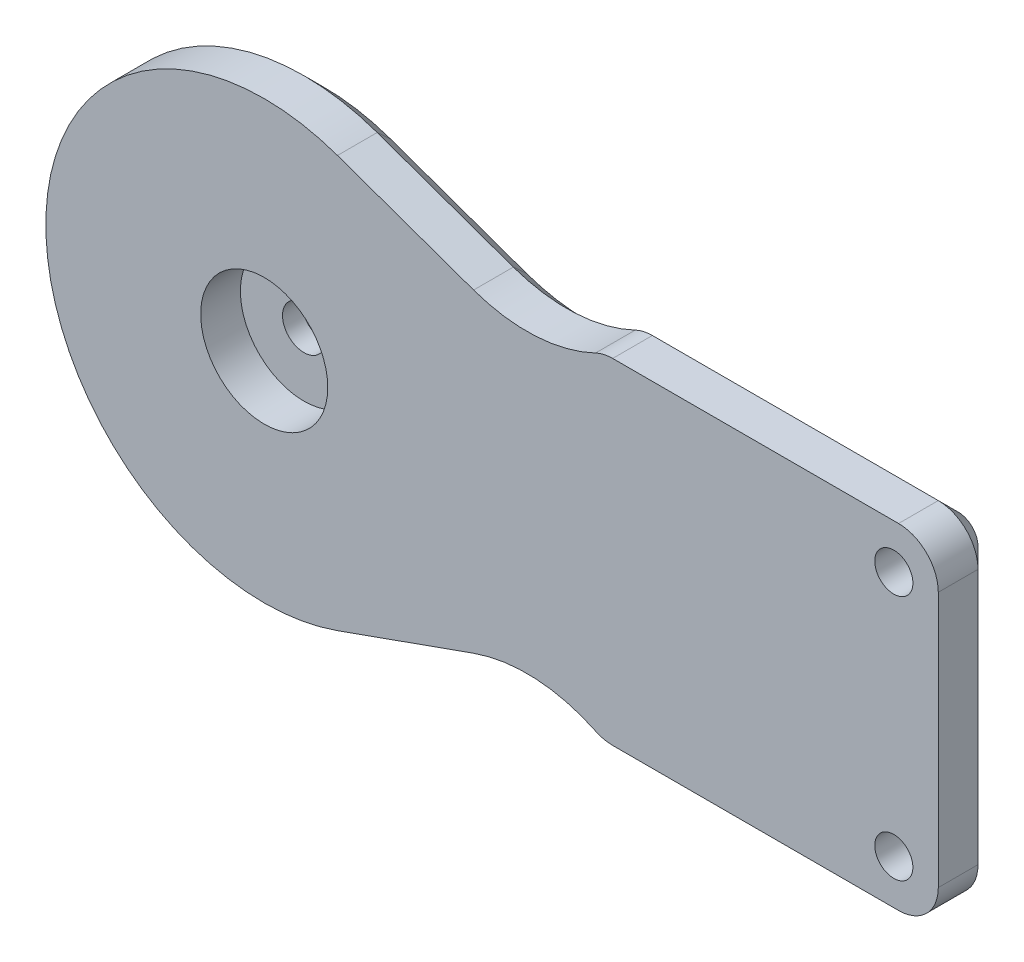
from build123d import *

# Parameters (mm, degrees)
SKETCH1_R                    = 1.5
SKETCH1_R_2                  = 2.7
BOSS_EXTRUDE1_DEPTH          = 7.5
SKETCH3_R                    = 8
CUT_EXTRUDE2_DEPTH           = 5
FILLET2_R                    = 20
TALADRO_DE_MARGEN_PARA_M41_D = 4.8
FILLET3_R                    = 5
CHAMFER1_SIZE                = 2.5
SKETCH7_W                    = 10.89
SKETCH7_H                    = 9.13
SKETCH7_W_2                  = 8.49
SKETCH7_H_2                  = 6.73
BOSS_EXTRUDE2_DEPTH          = 15
FILLET5_R                    = 2.5


with BuildPart() as part:
    # Sketch1 → Boss-Extrude1 (new body)
    with BuildSketch(Plane.XY):
        with BuildLine():
            Line((42.669600757, 14), (42.669600757, 21.1))
            Line((42.669600757, 21.1), (84.869600757, 21.1))
            Line((84.869600757, 21.1), (84.869600757, -21.1))
            Line((84.869600757, -21.1), (42.669600757, -21.1))
            Line((42.669600757, -21.1), (42.669600757, -14))
            Line((42.669600757, -14), (9.223174911, -25.907200632))
            ThreePointArc((9.223174911, -25.907200632), (-27.5, 0), (9.223174911, 25.907200632))
            Line((9.223174911, 25.907200632), (42.669600757, 14))
        make_face()
        with Locations((79.269600757, 15.5)):
            Circle(SKETCH1_R, mode=Mode.SUBTRACT)
        with Locations((79.269600757, -15.5)):
            Circle(SKETCH1_R, mode=Mode.SUBTRACT)
        Circle(SKETCH1_R_2, mode=Mode.SUBTRACT)
    extrude(amount=BOSS_EXTRUDE1_DEPTH)

    # Sketch3 → Cut-Extrude2 (cut)
    with BuildSketch(Plane.XY.offset(7.5)):
        Circle(SKETCH3_R)
    extrude(amount=-CUT_EXTRUDE2_DEPTH, mode=Mode.SUBTRACT)

    # Fillet2
    # the kernel refuses this fillet: 20 mm, written as the material it adds along each edge
    with BuildSketch(Plane(origin=(42.669600757, -14, 0), x_dir=(-0.9420800229659998, -0.3353881785757827, 0), z_dir=(0, 0, 1))) as fillet2_piece_1:
        with BuildLine():
            CenterArc((17.308114645, 20), FILLET2_R, 221.725423621, 48.274576379)
            Line((2.381256068, 6.688768163), (2.082718896, 6.422543526))
            ThreePointArc((2.082718896, 6.422543526), (0.813796025, 3.478539353), (-0.376832009, 0.134155271))
            Line((-0.376832009, 0.134155271), (0, -0.4))
            Line((0, -0.4), (17.308114645, -0.4))
            Line((17.308114645, -0.4), (17.308114645, 0))
        make_face()
    extrude(amount=7.5)
    with BuildSketch(Plane(origin=(42.669600757, 14, 0), x_dir=(-0.9420800229659999, 0.3353881785757825, 0), z_dir=(0, 0, 1))) as fillet2_piece_2:
        with BuildLine():
            CenterArc((17.308114645, -20), FILLET2_R, 90, 48.274576379)
            Line((2.381256068, -6.688768163), (2.082718896, -6.422543526))
            ThreePointArc((2.082718896, -6.422543526), (0.813796025, -3.478539353), (-0.376832009, -0.134155271))
            Line((-0.376832009, -0.134155271), (0, 0.4))
            Line((0, 0.4), (17.308114645, 0.4))
            Line((17.308114645, 0.4), (17.308114645, 0))
        make_face()
    extrude(amount=7.5)

    # Taladro de margen para M41 (through all)
    with Locations(Plane.XY.offset(7.5)):
        with Locations((79.269600757, -15.5), (79.269600757, 15.5)):
            Hole(TALADRO_DE_MARGEN_PARA_M41_D / 2)

    # Fillet3
    fillet3_edges = [part.edges().sort_by_distance(p)[0] for p in [
        (42.669600757, 21.1, 3.75),
        (84.869600757, 21.1, 3.75),
        (84.869600757, -21.1, 3.75),
        (42.669600757, -21.1, 3.75),
    ]]
    fillet(fillet3_edges, radius=FILLET3_R)

    # Chamfer1
    chamfer1_edges = [part.edges().sort_by_distance(p)[0] for p in [
        (17.793573313, -22.856068838, 0),
        (-27.5, 0, 0),
        (17.793573313, 22.856068838, 0),
        (34.118456698, 18.673946929, 0),
        (84.869600757, 0, 0),
        (61.870983905, 21.1, 0),
        (61.870983905, -21.1, 0),
        (34.118456698, -18.673946929, 0),
        (42.76478805, 20.975783912, 0),
        (42.76478805, -20.975783912, 0),
        (83.405134663, 19.635533906, 0),
        (83.405134663, -19.635533906, 0),
    ]]
    chamfer(chamfer1_edges, length=CHAMFER1_SIZE)

    # Sketch7 → Boss-Extrude2 (add)
    with BuildSketch(Plane(origin=(0, 0, 0), x_dir=(-1, 0, 0), z_dir=(0, 0, -1))):
        Rectangle(SKETCH7_W, SKETCH7_H)
        Rectangle(SKETCH7_W_2, SKETCH7_H_2, mode=Mode.SUBTRACT)
    extrude(amount=BOSS_EXTRUDE2_DEPTH)

    # Fillet5
    fillet5_edges = [part.edges().sort_by_distance(p)[0] for p in [
        (5.445, 4.565, -7.5),
        (5.445, -4.565, -7.5),
        (-5.445, -4.565, -7.5),
        (-5.445, 4.565, -7.5),
    ]]
    fillet(fillet5_edges, radius=FILLET5_R)


solid = part.part
